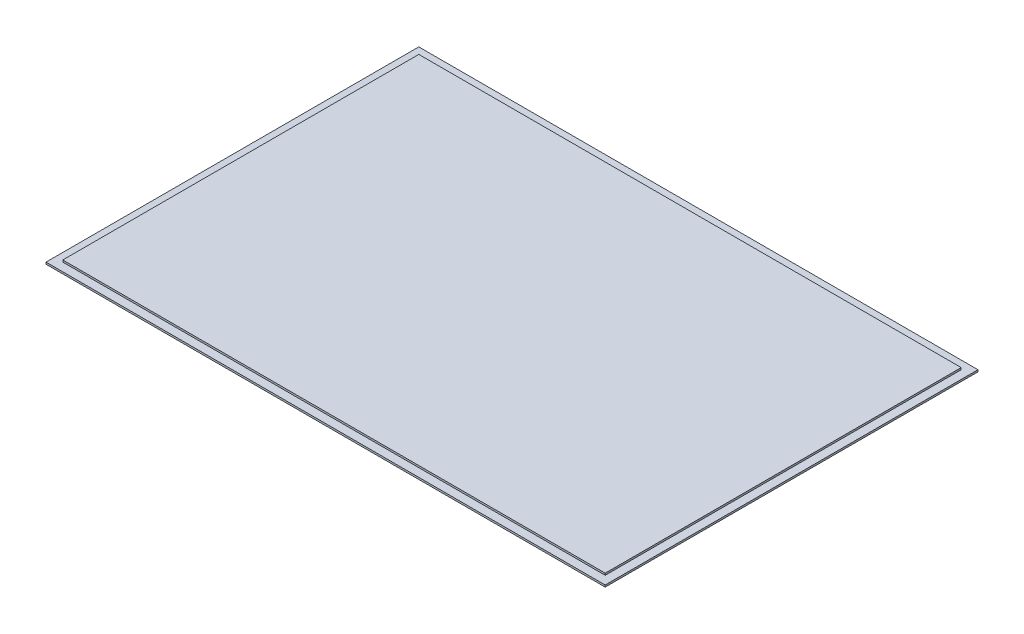
from build123d import *

# Parameters (mm, degrees)
SKETCH1_W           = 600
SKETCH1_H           = 400
BOSS_EXTRUDE1_DEPTH = 2
SKETCH1_3_W         = 582
SKETCH1_3_H         = 382
BOSS_EXTRUDE2_DEPTH = 4


with BuildPart() as part:
    # Sketch1 → Boss-Extrude1 (new body)
    with BuildSketch(Plane(origin=(0, 0, 0), x_dir=(1, 0, 0), z_dir=(0, 1, 0))):
        with Locations((300, 200)):
            Rectangle(SKETCH1_W, SKETCH1_H)
    extrude(amount=BOSS_EXTRUDE1_DEPTH)

    # Sketch1<3> → Boss-Extrude2 (add)
    with BuildSketch(Plane(origin=(0, 0, 0), x_dir=(1, 0, 0), z_dir=(0, 1, 0))):
        with Locations((300, 200)):
            Rectangle(SKETCH1_3_W, SKETCH1_3_H)
    extrude(amount=BOSS_EXTRUDE2_DEPTH)


solid = part.part
